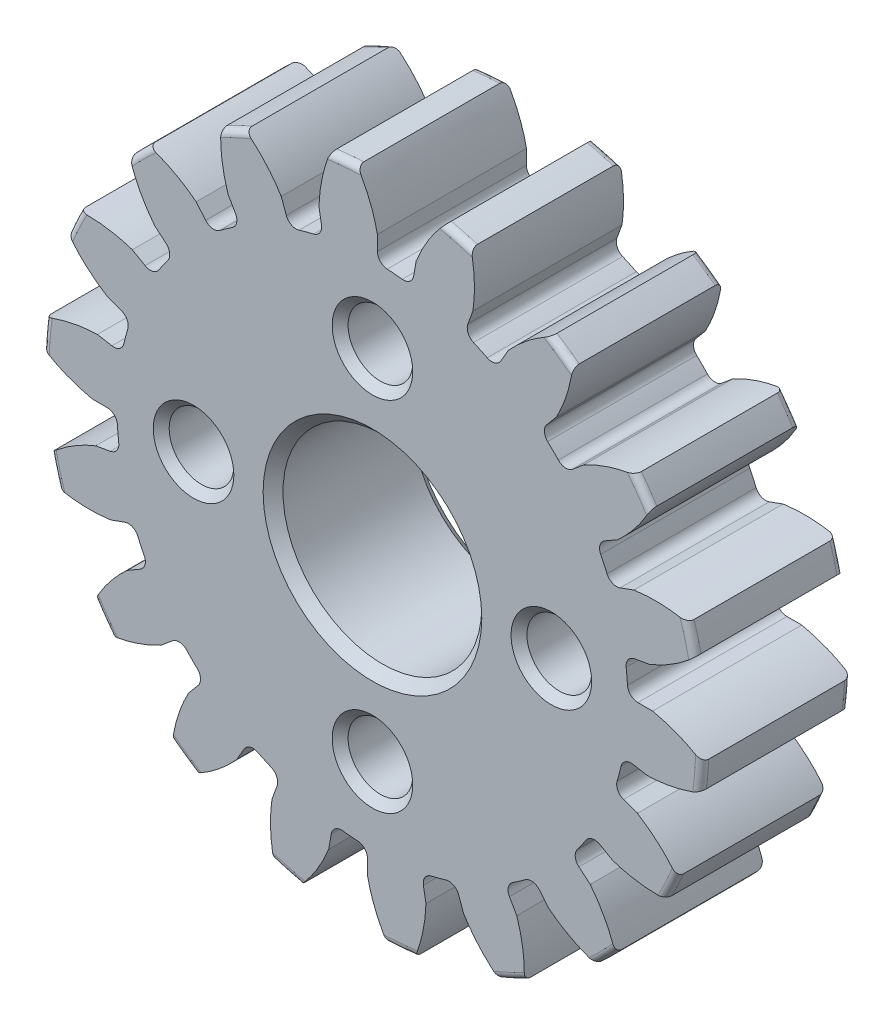
from build123d import *

# Parameters (mm, degrees)
SKETCH1_R                = 10.541
BOSS_EXTRUDE1_DEPTH      = 4.7625
SKETCH2_W                = 6.3373
SKETCH2_H                = 6.35
FILLET2_R                = 0.21082
CUT_EXTRUDE1_DEPTH       = 19.585772146
FILLET1_R                = 0.332486
CIRPATTERN1_COUNT        = 18
FILLET1_OF_CIRPATTERN1_R = 0.332486
SKETCH5_R                = 3.175
CUT_EXTRUDE2_DEPTH       = 19.572998108
SKETCH6_R                = 9.525
CUT_EXTRUDE3_DEPTH       = 17.183697661
CHAMFER1_SIZE            = 0.3175
CUT_EXTRUDE5_DEPTH       = 16.634324606
CUT_EXTRUDE5_DEPTH_BACK  = 16.634324606
SKETCH7_R                = 1.03251
CHAMFER2_SIZE            = 0.254


with BuildPart() as part:
    # Sketch1 → Boss-Extrude1 (new body)
    with BuildSketch(Plane.XY):
        Circle(SKETCH1_R)
    extrude(amount=-BOSS_EXTRUDE1_DEPTH)

    # Sketch2 → Revolve1 (revolve)
    with BuildSketch(Plane(origin=(0, 0, 0), x_dir=(0, 0, -1), z_dir=(1, 0, 0))):
        with Locations((7.93115, 3.175)):
            Rectangle(SKETCH2_W, SKETCH2_H)
    revolve(axis=Axis((0, 0, -4.7625), (0, 0, -1)))

    # Fillet2
    fillet2_edges = [part.edges().sort_by_distance(p)[0] for p in [
        (-10.541, 0, -4.7625),
        (-10.541, 0, 0),
        (0, -6.35, -4.7625),
    ]]
    fillet(fillet2_edges, radius=FILLET2_R)

    # Sketch4 → Cut-Extrude1 (cut, through all)
    with BuildSketch(Plane.XY):
        with BuildLine():
            Line((0.157561629, 8.949185285), (0.157561629, 8.158228631))
            ThreePointArc((0.157561629, 8.158228631), (0.711170731, 8.128699543), (1.261496911, 8.061646582))
            Line((1.261496911, 8.061646582), (1.398845411, 8.840586771))
            add(Edge.make_bspline(
                [(4.497758077, 11.696351513), (2.192075376, 10.823747212), (1.398845411, 8.840586771)],
                knots=[0, 0, 0, 1, 1, 1], degree=2))
            ThreePointArc((4.497758077, 11.696351513), (1.092180738, 12.483653619), (-2.39837188, 12.299686125))
            add(Edge.make_bspline(
                [(-2.39837188, 12.299686125), (-0.279244341, 11.039960179), (0.157561629, 8.949185285)],
                knots=[0, 0, 0, 1, 1, 1], degree=2))
        make_face()
    cut_extrude1 = extrude(amount=-CUT_EXTRUDE1_DEPTH, mode=Mode.SUBTRACT)

    # Fillet1
    fillet1_edges = [part.edges().sort_by_distance(p)[0] for p in [
        (1.261496911, 8.061646582, -2.38125),
        (0.157561629, 8.158228631, -2.38125),
    ]]
    fillet(fillet1_edges, radius=FILLET1_R)

    # CirPattern1: Cut-Extrude1 ×18 about axis
    cirpattern1_axis = Axis((0, 0, -4.7625), (0, 0, 1))
    for i in range(1, CIRPATTERN1_COUNT):
        add(cut_extrude1.rotate(cirpattern1_axis, i * 360 / CIRPATTERN1_COUNT), mode=Mode.SUBTRACT)

    # Fillet1 of CirPattern1
    fillet1_of_cirpattern1_edges = [part.edges().sort_by_distance(p)[0] for p in [
        (-1.57182618, 8.006927158, -2.38125),
        (-2.642219026, 7.720116494, -2.38125),
        (-4.215563837, 6.98645415, -2.38125),
        (-5.123309071, 6.350844371, -2.38125),
        (-6.35084228, 5.123311663, -2.38125),
        (-6.98645243, 4.215566689, -2.38125),
        (-7.720115416, 2.642222177, -2.38125),
        (-8.006926517, 1.571829448, -2.38125),
        (-8.158228695, -0.157558299, -2.38125),
        (-8.061647096, -1.261493621, -2.38125),
        (-7.612339192, -2.938334919, -2.38125),
        (-7.144014059, -3.942661942, -2.38125),
        (-6.148289235, -5.364704982, -2.38125),
        (-5.364707491, -6.148287046, -2.38125),
        (-3.942664858, -7.14401245, -2.38125),
        (-2.938338026, -7.612337992, -2.38125),
        (-1.261496911, -8.061646582, -2.38125),
        (-0.157561629, -8.158228631, -2.38125),
        (1.57182618, -8.006927158, -2.38125),
        (2.642219026, -7.720116494, -2.38125),
        (4.215563837, -6.98645415, -2.38125),
        (5.123309071, -6.350844371, -2.38125),
        (6.35084228, -5.123311663, -2.38125),
        (6.98645243, -4.215566689, -2.38125),
        (7.720115416, -2.642222177, -2.38125),
        (8.006926517, -1.571829448, -2.38125),
        (8.158228695, 0.157558299, -2.38125),
        (8.061647096, 1.261493621, -2.38125),
        (7.612339192, 2.938334919, -2.38125),
        (7.144014059, 3.942661942, -2.38125),
        (6.148289235, 5.364704982, -2.38125),
        (5.364707491, 6.148287046, -2.38125),
        (3.942664858, 7.14401245, -2.38125),
        (2.938338026, 7.612337992, -2.38125),
    ]]
    fillet(fillet1_of_cirpattern1_edges, radius=FILLET1_OF_CIRPATTERN1_R)

    # Sketch5 → Cut-Extrude2 (cut, through all)
    with BuildSketch(Plane.XY):
        Circle(SKETCH5_R)
    extrude(amount=-CUT_EXTRUDE2_DEPTH, mode=Mode.SUBTRACT)

    # Sketch6 → Cut-Extrude3 (cut, through all)
    with BuildSketch(Plane(origin=(0, 0, -4.7625), x_dir=(-1, 0, 0), z_dir=(0, 0, -1))):
        Circle(SKETCH6_R)
    extrude(amount=CUT_EXTRUDE3_DEPTH, mode=Mode.SUBTRACT)

    # Chamfer1
    chamfer1_edges = [part.edges().sort_by_distance(p)[0] for p in [
        (-3.175, 0, 0),
        (-3.175, 0, -4.7625),
    ]]
    chamfer(chamfer1_edges, length=CHAMFER1_SIZE)

    # Sketch7 → Cut-Extrude5 (cut, two sides: drawn at the far end of the back side and taken through both)
    with BuildSketch(Plane(origin=(0, 0, -4.7625), x_dir=(-1, 0, 0), z_dir=(0, 0, -1)).offset(-CUT_EXTRUDE5_DEPTH_BACK)):
        with Locations((0, 5.715)):
            Circle(SKETCH7_R)
        with Locations((-5.715, 0)):
            Circle(SKETCH7_R)
        with Locations((0, -5.715)):
            Circle(SKETCH7_R)
        with Locations((5.715, 0)):
            Circle(SKETCH7_R)
    extrude(amount=CUT_EXTRUDE5_DEPTH + CUT_EXTRUDE5_DEPTH_BACK, mode=Mode.SUBTRACT)

    # Chamfer2
    chamfer2_edges = [part.edges().sort_by_distance(p)[0] for p in [
        (1.03251, -5.715, -4.7625),
        (1.03251, -5.715, 0),
        (6.74751, 0, 0),
        (6.74751, 0, -4.7625),
        (-4.68249, 0, -4.7625),
        (-4.68249, 0, 0),
        (1.03251, 5.715, -4.7625),
        (1.03251, 5.715, 0),
    ]]
    chamfer(chamfer2_edges, length=CHAMFER2_SIZE)


solid = part.part
